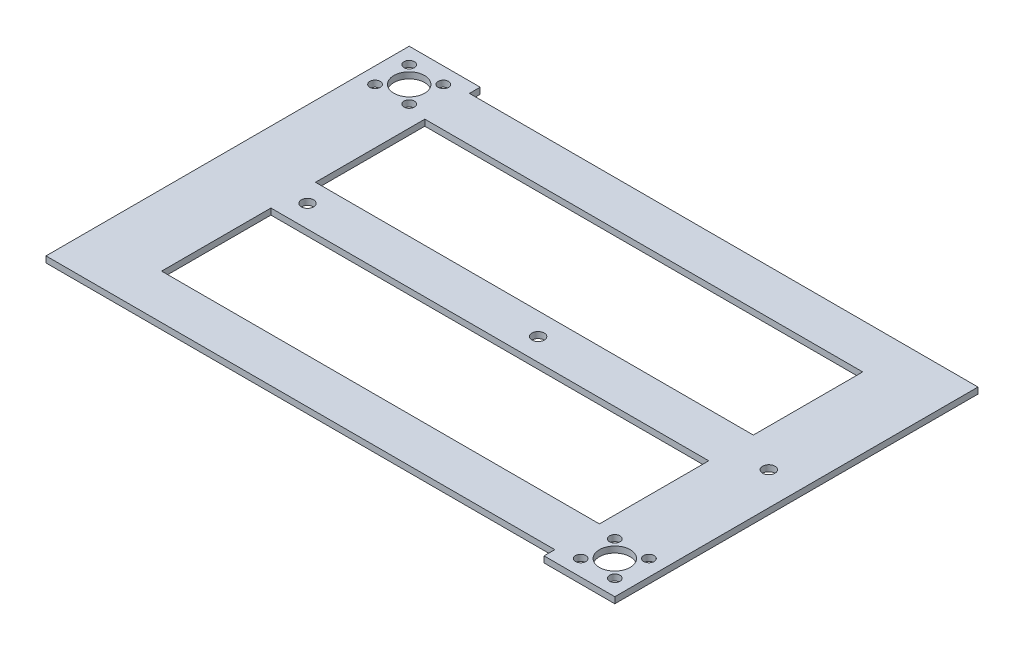
from build123d import *

# Parameters (mm, degrees)
SKETCH1_R           = 5
SKETCH1_R_2         = 1.7
SKETCH1_R_3         = 2
SKETCH1_W           = 142.3736446
SKETCH1_H           = 35.551129401
SKETCH1_H_2         = 35.551129402
BOSS_EXTRUDE1_DEPTH = 2


with BuildPart() as part:
    # Sketch1 → Boss-Extrude1 (new body)
    with BuildSketch(Plane(origin=(0, 0, 0), x_dir=(1, 0, 0), z_dir=(0, 1, 0))):
        Polygon((67.730491212, 150.133829438), (82.230491212, 150.133829438), (85.730491212, 150.133829438), (85.730491212, 100.082700036), (85.730491212, 85.582700036), (85.730491212, 50.031570635), (85.730491212, 32.031570635), (67.730491212, 32.031570635), (62.730491212, 32.031570635), (62.730491212, 35.531570635), (-84.727026002, 35.531570635), (-99.227026002, 35.531570635), (-102.727026002, 35.531570635), (-102.727026002, 85.582700036), (-102.727026002, 100.082700036), (-102.727026002, 153.633829438), (-84.643153388, 153.633829438), (-79.643153388, 153.633829438), (-79.643153388, 153.432122466), (-79.643153388, 150.133829438), align=None)
        with Locations((-91.977026002, 142.883829438)):
            Circle(SKETCH1_R, mode=Mode.SUBTRACT)
        with Locations((74.980491212, 42.781570635)):
            Circle(SKETCH1_R, mode=Mode.SUBTRACT)
        with Locations((-86.427026002, 148.433829438)):
            Circle(SKETCH1_R_2, mode=Mode.SUBTRACT)
        with Locations((-97.527026002, 148.433829438)):
            Circle(SKETCH1_R_2, mode=Mode.SUBTRACT)
        with Locations((-86.427026002, 137.333829438)):
            Circle(SKETCH1_R_2, mode=Mode.SUBTRACT)
        with Locations((-97.527026002, 137.333829438)):
            Circle(SKETCH1_R_2, mode=Mode.SUBTRACT)
        with Locations((69.430491212, 48.331570635)):
            Circle(SKETCH1_R_2, mode=Mode.SUBTRACT)
        with Locations((80.530491212, 48.331570635)):
            Circle(SKETCH1_R_2, mode=Mode.SUBTRACT)
        with Locations((80.530491212, 37.231570635)):
            Circle(SKETCH1_R_2, mode=Mode.SUBTRACT)
        with Locations((69.430491212, 37.231570635)):
            Circle(SKETCH1_R_2, mode=Mode.SUBTRACT)
        with Locations((-75, 92.833829438)):
            Circle(SKETCH1_R_3, mode=Mode.SUBTRACT)
        with Locations((0, 92.833829438)):
            Circle(SKETCH1_R_3, mode=Mode.SUBTRACT)
        with Locations((75, 92.833829438)):
            Circle(SKETCH1_R_3, mode=Mode.SUBTRACT)
        with Locations((-8.456331088, 67.807135336)):
            Rectangle(SKETCH1_W, SKETCH1_H, mode=Mode.SUBTRACT)
        with Locations((-8.456331088, 117.858264737)):
            Rectangle(SKETCH1_W, SKETCH1_H_2, mode=Mode.SUBTRACT)
    extrude(amount=BOSS_EXTRUDE1_DEPTH)


solid = part.part
